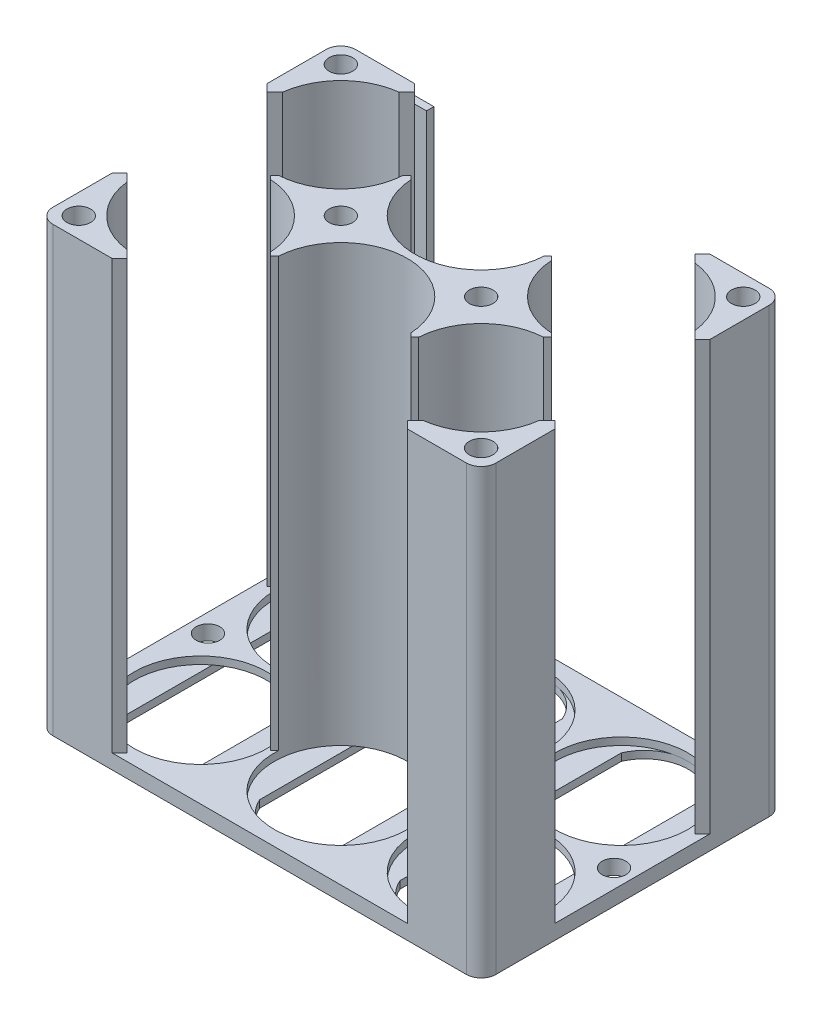
from build123d import *

# Parameters (mm, degrees)
SKETCH1_W           = 60
SKETCH1_H           = 41
BOSS_EXTRUDE1_DEPTH = 2
SKETCH2_R           = 9
CUT_EXTRUDE2_DEPTH  = 1
CUT_EXTRUDE3_DEPTH  = 1
SKETCH4_W           = 8
SKETCH4_H           = 8
CUT_EXTRUDE4_DEPTH  = 1
BOSS_EXTRUDE2_START = 58
BOSS_EXTRUDE2_DEPTH = 58
SKETCH6_R           = 1.6
CUT_EXTRUDE5_DEPTH  = 18
CHAMFER2_SIZE       = 0.5
CHAMFER3_SIZE       = 1
SKETCH7_R           = 1.6
CUT_EXTRUDE6_DEPTH  = 93.978492137
FILLET1_R           = 2
BOSS_EXTRUDE3_DEPTH = 2.6
SKETCH11_W          = 2.5
SKETCH11_H          = 1
BOSS_EXTRUDE4_DEPTH = 54
FILLET2_R           = 2


with BuildPart() as part:
    # Sketch1 → Boss-Extrude1 (new body)
    with BuildSketch(Plane(origin=(0, 0, 0), x_dir=(1, 0, 0), z_dir=(0, 1, 0))):
        with Locations((-30, 20.5)):
            Rectangle(SKETCH1_W, SKETCH1_H)
    extrude(amount=BOSS_EXTRUDE1_DEPTH)

    # Sketch2 → Cut-Extrude2 (cut)
    with BuildSketch(Plane(origin=(0, 2, 0), x_dir=(1, 0, 0), z_dir=(0, 1, 0))):
        with Locations(Location((-49, 11, 0), (0, 0, 270))):
            Circle(SKETCH2_R)
        with Locations(Location((-30, 11, 0), (0, 0, 270))):
            Circle(SKETCH2_R)
        with Locations(Location((-11, 11, 0), (0, 0, 270))):
            Circle(SKETCH2_R)
        with Locations(Location((-30, 30, 0), (0, 0, 270))):
            Circle(SKETCH2_R)
        with Locations(Location((-11, 30, 0), (0, 0, 270))):
            Circle(SKETCH2_R)
        with Locations(Location((-49, 30, 0), (0, 0, 270))):
            Circle(SKETCH2_R)
    extrude(amount=-CUT_EXTRUDE2_DEPTH, mode=Mode.SUBTRACT)

    # Sketch3 → Cut-Extrude3 (cut)
    with BuildSketch(Plane.XZ):
        with BuildLine():
            Line((-5.5, -35.497915762), (-5.5, -5.497915762))
            ThreePointArc((-5.5, -5.497915762), (-11, -1.895831523), (-16.5, -5.497915762))
            Line((-16.5, -5.497915762), (-16.5, -35.497915762))
            ThreePointArc((-16.5, -35.497915762), (-11, -39.1), (-5.5, -35.497915762))
        make_face()
        with BuildLine():
            Line((-35.5, -35.497915762), (-35.5, -5.497915762))
            ThreePointArc((-35.5, -5.497915762), (-30, -1.895831523), (-24.5, -5.497915762))
            Line((-24.5, -5.497915762), (-24.5, -35.497915762))
            ThreePointArc((-24.5, -35.497915762), (-30, -39.1), (-35.5, -35.497915762))
        make_face()
        with BuildLine():
            Line((-54.5, -35.497915762), (-54.5, -5.497915762))
            ThreePointArc((-54.5, -5.497915762), (-49, -1.895831523), (-43.5, -5.497915762))
            Line((-43.5, -5.497915762), (-43.5, -35.497915762))
            ThreePointArc((-43.5, -35.497915762), (-49, -39.1), (-54.5, -35.497915762))
        make_face()
    extrude(amount=-CUT_EXTRUDE3_DEPTH, mode=Mode.SUBTRACT)

    # Sketch4 → Cut-Extrude4 (cut)
    with BuildSketch(Plane.XZ):
        with Locations((-20.5, -20.501096576)):
            Rectangle(SKETCH4_W, SKETCH4_H)
    extrude(amount=-CUT_EXTRUDE4_DEPTH, mode=Mode.SUBTRACT)

    # Sketch5 → Boss-Extrude2 (add)
    with BuildSketch(Plane(origin=(0, 2, 0), x_dir=(1, 0, 0), z_dir=(0, 1, 0)).offset(BOSS_EXTRUDE2_START)):
        with BuildLine():
            Line((-20, 30), (-21, 30))
            ThreePointArc((-21, 30), (-23.636038969, 23.636038969), (-30, 21))
            ThreePointArc((-30, 21), (-36.363961031, 23.636038969), (-39, 30))
            Line((-39, 30), (-40, 30))
            ThreePointArc((-40, 30), (-42.636038969, 23.636038969), (-49, 21))
            Line((-49, 21), (-49, 20))
            ThreePointArc((-49, 20), (-42.636038969, 17.363961031), (-40, 11))
            Line((-40, 11), (-39, 11))
            ThreePointArc((-39, 11), (-36.363961031, 17.363961031), (-30, 20))
            ThreePointArc((-30, 20), (-23.636038969, 17.363961031), (-21, 11))
            Line((-21, 11), (-20, 11))
            ThreePointArc((-20, 11), (-17.363961031, 17.363961031), (-11, 20))
            Line((-11, 20), (-11, 21))
            ThreePointArc((-11, 21), (-17.363961031, 23.636038969), (-20, 30))
        make_face()
        with BuildLine():
            Line((-58, 30), (-60, 30))
            Line((-60, 30), (-60, 41))
            Line((-60, 41), (-49, 41))
            Line((-49, 41), (-49, 39))
            ThreePointArc((-49, 39), (-55.363961031, 36.363961031), (-58, 30))
        make_face()
        with BuildLine():
            Line((-58, 11), (-60, 11))
            Line((-60, 11), (-60, 0))
            Line((-60, 0), (-49, 0))
            Line((-49, 0), (-49, 2))
            ThreePointArc((-49, 2), (-55.363961031, 4.636038969), (-58, 11))
        make_face()
        with BuildLine():
            Line((-2, 11), (0, 11))
            Line((0, 11), (0, 0))
            Line((0, 0), (-11, 0))
            Line((-11, 0), (-11, 2))
            ThreePointArc((-11, 2), (-4.636038969, 4.636038969), (-2, 11))
        make_face()
        with BuildLine():
            Line((-2, 30), (0, 30))
            Line((0, 30), (0, 41))
            Line((0, 41), (-11, 41))
            Line((-11, 41), (-11, 39))
            ThreePointArc((-11, 39), (-4.636038969, 36.363961031), (-2, 30))
        make_face()
    extrude(amount=-BOSS_EXTRUDE2_DEPTH)

    # Sketch6 → Cut-Extrude5 (cut)
    with BuildSketch(Plane(origin=(0, 60, 0), x_dir=(1, 0, 0), z_dir=(0, 1, 0))):
        with Locations(Location((-20.5, 20.5, 0), (0, 0, 270))):
            Circle(SKETCH6_R)
        with Locations(Location((-39.5, 20.5, 0), (0, 0, 270))):
            Circle(SKETCH6_R)
        with Locations(Location((-57.25, 2.75, 0), (0, 0, 270))):
            Circle(SKETCH6_R)
        with Locations(Location((-57.25, 38.25, 0), (0, 0, 270))):
            Circle(SKETCH6_R)
        with Locations(Location((-2.75, 2.75, 0), (0, 0, 270))):
            Circle(SKETCH6_R)
        with Locations(Location((-2.75, 38.25, 0), (0, 0, 270))):
            Circle(SKETCH6_R)
    extrude(amount=-CUT_EXTRUDE5_DEPTH, mode=Mode.SUBTRACT)

    # Chamfer2
    # the kernel refuses this chamfer: 0.5 mm, written as the material it takes off along each edge
    with BuildSketch(Plane(origin=(-40, 61.324152825, -11), x_dir=(1, 0, 0), z_dir=(0, -1, 0)), Plane(origin=(-21, 61.324152825, -11), x_dir=(1, 0, 0), z_dir=(0, -1, 0)), Plane(origin=(-49, 61.324152825, -21), x_dir=(0, 0, 1), z_dir=(0, -1, 0)), Plane(origin=(-39, 61.324152825, -30), x_dir=(-1, 0, 0), z_dir=(0, -1, 0)), Plane(origin=(-20, 61.324152825, -30), x_dir=(-1, 0, 0), z_dir=(0, -1, 0)), Plane(origin=(-11, 61.324152825, -20), x_dir=(0, 0, -1), z_dir=(0, -1, 0))) as chamfer2_piece_1:
        with BuildLine():
            Line((CHAMFER2_SIZE, 0), (-0.014731413, -0.514731413))
            ThreePointArc((-0.014731413, -0.514731413), (-0.003894786, -0.264747015), (0, 0))
            Line((0, 0), (CHAMFER2_SIZE, 0))
        make_face()
    extrude(amount=59.324152825, mode=Mode.SUBTRACT)
    with BuildSketch(Plane(origin=(-39, 61.324152825, -11), x_dir=(-1, 0, 0), z_dir=(0, -1, 0)), Plane(origin=(-20, 61.324152825, -11), x_dir=(-1, 0, 0), z_dir=(0, -1, 0)), Plane(origin=(-40, 61.324152825, -30), x_dir=(1, 0, 0), z_dir=(0, -1, 0)), Plane(origin=(-21, 61.324152825, -30), x_dir=(1, 0, 0), z_dir=(0, -1, 0)), Plane(origin=(-11, 61.324152825, -21), x_dir=(0, 0, 1), z_dir=(0, -1, 0))) as chamfer2_piece_2:
        with BuildLine():
            Line((CHAMFER2_SIZE, 0), (-0.014731413, 0.514731413))
            ThreePointArc((-0.014731413, 0.514731413), (-0.003894786, 0.264747015), (0, 0))
            Line((0, 0), (CHAMFER2_SIZE, 0))
        make_face()
    extrude(amount=59.324152825, mode=Mode.SUBTRACT)
    with BuildSketch(Plane(origin=(-49, 61.324152825, -20), x_dir=(0.999590710311118, 0, 0.02860789855467639), z_dir=(0, -1, 0))) as chamfer2_piece_3:
        with BuildLine():
            Line((0.514942174, 0), (-CHAMFER2_SIZE * 0.0286078985547, -CHAMFER2_SIZE * 0.999590710311))
            Line((-CHAMFER2_SIZE * 0.0286078985547, -CHAMFER2_SIZE * 0.999590710311), (0, 0))
            ThreePointArc((0, 0), (0.264750079, -0.003680664), (0.514942174, 0))
        make_face()
    extrude(amount=59.324152825, mode=Mode.SUBTRACT)

    # Chamfer3
    # the kernel refuses this chamfer: 1 mm, written as the material it takes off along each edge
    with BuildSketch(Plane(origin=(-2, 62.73772815, -30), x_dir=(1, 0, 0), z_dir=(0, -1, 0)), Plane(origin=(-49, 62.73772815, -39), x_dir=(0, 0, -1), z_dir=(0, -1, 0)), Plane(origin=(-11, 62.73772815, -2), x_dir=(0, 0, 1), z_dir=(0, -1, 0))) as chamfer3_piece_1:
        with BuildLine():
            Line((CHAMFER3_SIZE, 0), (-0.062996063, -1.062996063))
            ThreePointArc((-0.062996063, -1.062996063), (-0.016662827, -0.547405922), (0, 0))
            Line((0, 0), (CHAMFER3_SIZE, 0))
        make_face()
    extrude(amount=60.73772815, mode=Mode.SUBTRACT)
    with BuildSketch(Plane(origin=(0, 62.571682988, -30), x_dir=(0, 0, -1), z_dir=(0, -1, 0)), Plane(origin=(-49, 62.571682988, -41), x_dir=(-1, 0, 0), z_dir=(0, -1, 0)), Plane(origin=(-60, 62.571682988, -11), x_dir=(0, 0, 1), z_dir=(0, -1, 0)), Plane(origin=(-11, 62.571682988, 0), x_dir=(1, 0, 0), z_dir=(0, -1, 0))) as chamfer3_piece_2:
        Polygon((CHAMFER3_SIZE, 0), (0, -CHAMFER3_SIZE), (0, 0), align=None)
    extrude(amount=60.571682988, mode=Mode.SUBTRACT)
    with BuildSketch(Plane(origin=(-11, 62.73772815, -39), x_dir=(0, 0, -1), z_dir=(0, -1, 0)), Plane(origin=(-58, 62.73772815, -30), x_dir=(-1, 0, 0), z_dir=(0, -1, 0)), Plane(origin=(-49, 62.73772815, -2), x_dir=(0, 0, 1), z_dir=(0, -1, 0)), Plane(origin=(-2, 62.73772815, -11), x_dir=(1, 0, 0), z_dir=(0, -1, 0))) as chamfer3_piece_3:
        with BuildLine():
            Line((CHAMFER3_SIZE, 0), (-0.062996063, 1.062996063))
            ThreePointArc((-0.062996063, 1.062996063), (-0.016662827, 0.547405922), (0, 0))
            Line((0, 0), (CHAMFER3_SIZE, 0))
        make_face()
    extrude(amount=60.73772815, mode=Mode.SUBTRACT)
    with BuildSketch(Plane(origin=(-11, 62.571682988, -41), x_dir=(1, 0, 0), z_dir=(0, -1, 0)), Plane(origin=(-60, 62.571682988, -30), x_dir=(0, 0, -1), z_dir=(0, -1, 0)), Plane(origin=(-49, 62.571682988, 0), x_dir=(-1, 0, 0), z_dir=(0, -1, 0)), Plane(origin=(0, 62.571682988, -11), x_dir=(0, 0, 1), z_dir=(0, -1, 0))) as chamfer3_piece_4:
        Polygon((CHAMFER3_SIZE, 0), (0, CHAMFER3_SIZE), (0, 0), align=None)
    extrude(amount=60.571682988, mode=Mode.SUBTRACT)
    with BuildSketch(Plane(origin=(-58, 62.73772815, -11), x_dir=(0.05915894925917608, 0, 0.9982485756175915), z_dir=(0, -1, 0))) as chamfer3_piece_5:
        with BuildLine():
            Line((1.064861087, 0), (-CHAMFER3_SIZE * 0.0591589492592, CHAMFER3_SIZE * 0.998248575618))
            Line((-CHAMFER3_SIZE * 0.0591589492592, CHAMFER3_SIZE * 0.998248575618), (0, 0))
            ThreePointArc((0, 0), (0.547432937, 0.015750315), (1.064861087, 0))
        make_face()
    extrude(amount=60.73772815, mode=Mode.SUBTRACT)

    # Sketch7 → Cut-Extrude6 (cut, through all)
    with BuildSketch(Plane(origin=(0, 2, 0), x_dir=(1, 0, 0), z_dir=(0, 1, 0))):
        with Locations(Location((-57.5, 20.5, 0), (0, 0, 270))):
            Circle(SKETCH7_R)
        with Locations(Location((-2.5, 20.5, 0), (0, 0, 270))):
            Circle(SKETCH7_R)
    extrude(amount=-CUT_EXTRUDE6_DEPTH, mode=Mode.SUBTRACT)

    # Fillet1
    # the kernel refuses this fillet: 2 mm, written as the material it takes off along each edge
    with BuildSketch(Plane(origin=(-16.5, -5, -16.501096576), x_dir=(0, 0, 1), z_dir=(0, 1, 0)), Plane(origin=(-24.5, -5, -16.501096576), x_dir=(1, 0, 0), z_dir=(0, 1, 0))) as fillet1_piece_1:
        with BuildLine():
            CenterArc((FILLET1_R, -FILLET1_R), FILLET1_R, 90, 90)
            Line((0, -FILLET1_R), (0, 0))
            Line((0, 0), (FILLET1_R, 0))
        make_face()
    extrude(amount=6, mode=Mode.SUBTRACT)
    with BuildSketch(Plane(origin=(-16.5, -5, -24.501096576), x_dir=(0, 0, -1), z_dir=(0, 1, 0)), Plane(origin=(-24.5, -5, -24.501096576), x_dir=(1, 0, 0), z_dir=(0, 1, 0))) as fillet1_piece_2:
        with BuildLine():
            CenterArc((FILLET1_R, FILLET1_R), FILLET1_R, 180, 90)
            Line((0, FILLET1_R), (0, 0))
            Line((0, 0), (FILLET1_R, 0))
        make_face()
    extrude(amount=6, mode=Mode.SUBTRACT)
    with BuildSketch(Plane(origin=(0, -5, 0), x_dir=(-1, 0, 0), z_dir=(0, 1, 0)), Plane(origin=(-60, 65, 0), x_dir=(1, 0, 0), z_dir=(0, -1, 0)), Plane(origin=(-60, 65, -41), x_dir=(0, 0, 1), z_dir=(0, -1, 0)), Plane(origin=(0, -5, -41), x_dir=(0, 0, 1), z_dir=(0, 1, 0))) as fillet1_piece_3:
        with BuildLine():
            CenterArc((FILLET1_R, -FILLET1_R), FILLET1_R, 90, 90)
            Line((0, -FILLET1_R), (0, 0))
            Line((0, 0), (FILLET1_R, 0))
        make_face()
    extrude(amount=70, mode=Mode.SUBTRACT)

    # Sketch9 → Boss-Extrude3 (add)
    with BuildSketch(Plane(origin=(0, 0, -41), x_dir=(-1, 0, 0), z_dir=(0, 0, -1))):
        Polygon((52.5, 0), (54.5, 0), (54.5, 56), (52.5, 56), (52.5, 2), (50, 2), (50, 0), align=None)
        Polygon((5.5, 0), (7.5, 0), (10, 0), (10, 2), (7.5, 2), (7.5, 56), (5.5, 56), align=None)
    extrude(amount=BOSS_EXTRUDE3_DEPTH)

    # Sketch11 → Boss-Extrude4 (add)
    with BuildSketch(Plane(origin=(0, 2, 0), x_dir=(1, 0, 0), z_dir=(0, 1, 0))):
        with Locations((-8.75, 43.1)):
            Rectangle(SKETCH11_W, SKETCH11_H)
        with Locations((-51.25, 43.1)):
            Rectangle(SKETCH11_W, SKETCH11_H)
    extrude(amount=BOSS_EXTRUDE4_DEPTH)

    # Fillet2
    fillet2_edges = [part.edges().sort_by_distance(p)[0] for p in [
        (-54.5, 28, -43.6),
        (-5.5, 28, -43.6),
    ]]
    fillet(fillet2_edges, radius=FILLET2_R)


solid = part.part
